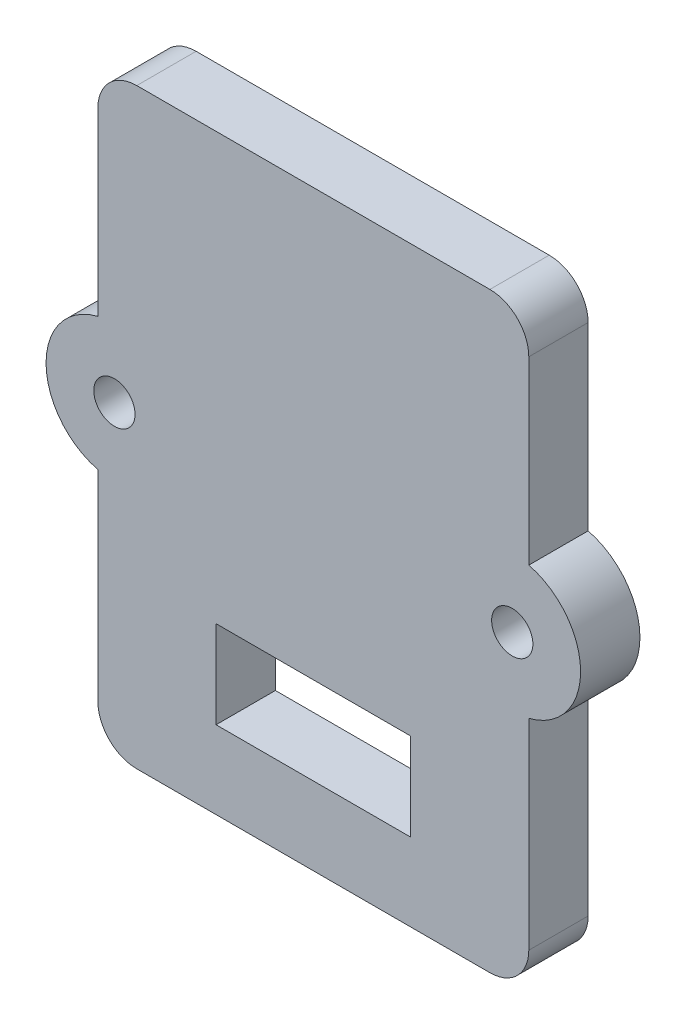
from build123d import *

# Parameters (mm, degrees)
SKETCH2_R           = 1.06
SKETCH2_W           = 10
SKETCH2_H           = 4.5
BOSS_EXTRUDE2_DEPTH = 3.05


with BuildPart() as part:
    # Sketch2 → Boss-Extrude2 (new body)
    with BuildSketch(Plane.XY):
        with BuildLine():
            Line((-11.075, 16.909233785), (-11.075, 26.183587826))
            ThreePointArc((-11.075, 26.183587826), (-10.489213562, 27.597801388), (-9.075, 28.183587826))
            Line((-9.075, 28.183587826), (9.075, 28.183587826))
            ThreePointArc((9.075, 28.183587826), (10.489213562, 27.597801388), (11.075, 26.183587826))
            Line((11.075, 26.183587826), (11.075, 16.909233785))
            ThreePointArc((11.075, 16.909233785), (13.738598583, 13.5), (11.075, 10.090766215))
            Line((11.075, 10.090766215), (11.075, -0.233587826))
            ThreePointArc((11.075, -0.233587826), (10.489213562, -1.647801388), (9.075, -2.233587826))
            Line((9.075, -2.233587826), (-9.075, -2.233587826))
            ThreePointArc((-9.075, -2.233587826), (-10.489213562, -1.647801388), (-11.075, -0.233587826))
            Line((-11.075, -0.233587826), (-11.075, 10.090766215))
            ThreePointArc((-11.075, 10.090766215), (-13.738598583, 13.5), (-11.075, 16.909233785))
        make_face()
        with Locations((-10.225, 13.5)):
            Circle(SKETCH2_R, mode=Mode.SUBTRACT)
        with Locations((10.225, 13.5)):
            Circle(SKETCH2_R, mode=Mode.SUBTRACT)
        with Locations((0, 4.016412174)):
            Rectangle(SKETCH2_W, SKETCH2_H, mode=Mode.SUBTRACT)
    extrude(amount=BOSS_EXTRUDE2_DEPTH)


solid = part.part
